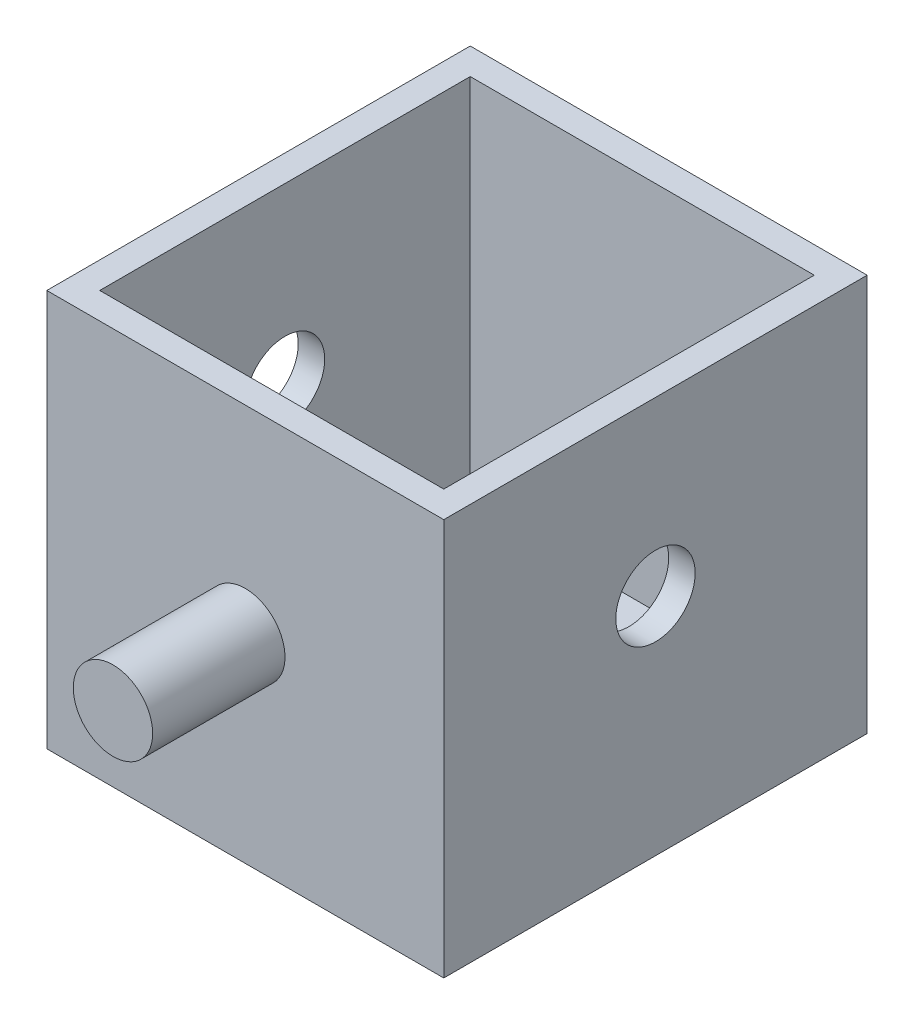
from build123d import *

# Parameters (mm, degrees)
SKETCH1_W          = 38.1
SKETCH1_H          = 38.1
MAIN_BODY_DEPTH    = 40.64
HOLLOW_IT_T        = -2.54
SKETCH3_R          = 3.81
NIBBLE_NO_1_DEPTH  = 12.7
NIBBLE_START       = 12.7
SKETCH4_R          = 3.81
NIBBLE_NO_2_DEPTH  = 12.7
SKETCH5_W          = 1.27
SKETCH5_H          = 3.81
FLAG_DEPTH         = 0.254
SKETCH2_R          = 3.81
NIBBLE_HOLES_DEPTH = 69.261761624


with BuildPart() as part:
    # Sketch1 → main body (new body)
    with BuildSketch(Plane.XY):
        Rectangle(SKETCH1_W, SKETCH1_H)
    extrude(amount=MAIN_BODY_DEPTH)

    # hollow it
    hollow_it_openings = [part.faces().sort_by_distance(p)[0] for p in [
        (0, 19.05, 20.32),
    ]]
    offset(amount=HOLLOW_IT_T, openings=hollow_it_openings, kind=Kind.INTERSECTION)

    # Sketch3 → nibble no 1 (add)
    with BuildSketch(Plane.XY.offset(40.64)):
        Circle(SKETCH3_R)
    extrude(amount=NIBBLE_NO_1_DEPTH)

    # Sketch4 → nibble no 2 (add)
    with BuildSketch(Plane(origin=(0, 0, 0), x_dir=(-1, 0, 0), z_dir=(0, 0, -1)).offset(NIBBLE_START)):
        Circle(SKETCH4_R)
    extrude(amount=-NIBBLE_NO_2_DEPTH)

    # Sketch5 → flag (add)
    with BuildSketch(Plane(origin=(0, 0, 0), x_dir=(-1, 0, 0), z_dir=(0, -1, 0))):
        with Locations((-0.18666561, 6.353298227)):
            Rectangle(SKETCH5_W, SKETCH5_H)
    extrude(amount=FLAG_DEPTH)

    # Sketch2 → nibble holes (cut, through all)
    with BuildSketch(Plane(origin=(19.05, 0, 0), x_dir=(0, 0, -1), z_dir=(1, 0, 0))):
        with Locations((-20.32, 2.54)):
            Circle(SKETCH2_R)
    extrude(amount=-NIBBLE_HOLES_DEPTH, mode=Mode.SUBTRACT)


solid = part.part
